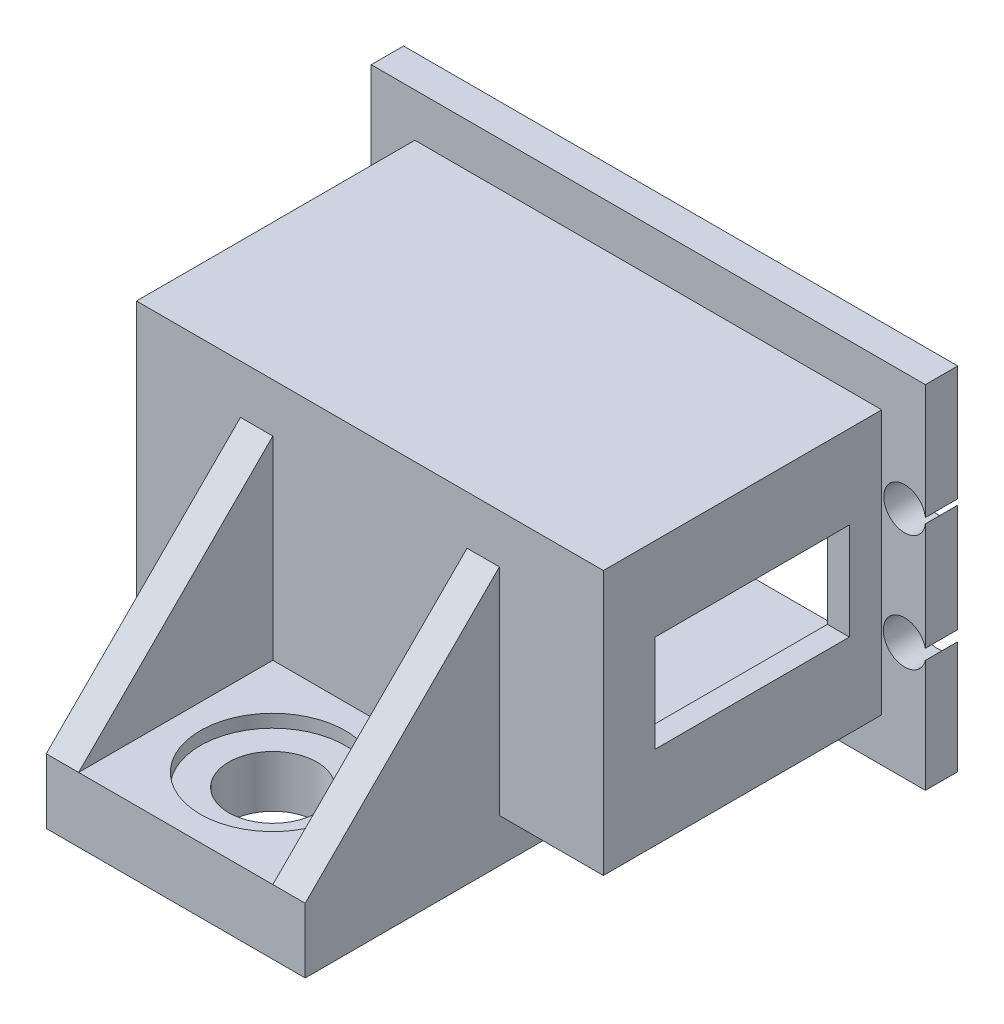
from build123d import *

# Parameters (mm, degrees)
SKETCH1_W           = 54.356
SKETCH1_H           = 34.4678
SKETCH1_W_2         = 40.2082
SKETCH1_H_2         = 20.32
BOSS_EXTRUDE1_DEPTH = 27.94
SKETCH2_W           = 54.356
SKETCH2_H           = 34.4678
SKETCH2_W_2         = 45.7962
SKETCH2_H_2         = 25.908
CUT_EXTRUDE1_DEPTH  = 24.765
SKETCH3_R           = 2.04968225
SKETCH3_R_2         = 2.0955
CUT_EXTRUDE2_DEPTH  = 43.618007851
SKETCH4_W           = 19.05
SKETCH4_H           = 9.525
CUT_EXTRUDE3_DEPTH  = 12.7
SKETCH5_W           = 45.7962
SKETCH5_H           = 25.908
BOSS_EXTRUDE2_DEPTH = 2.54
SKETCH6_W           = 25.4
SKETCH6_H           = 4.2799
BOSS_EXTRUDE3_DEPTH = 27.305
SKETCH7_W           = 25.4
SKETCH7_H           = 6.35
BOSS_EXTRUDE4_DEPTH = 19.05
SKETCH8_R           = 4.318
CUT_EXTRUDE4_DEPTH  = 19.05
SKETCH9_R           = 7.112
CUT_EXTRUDE5_DEPTH  = 1.27
SKETCH10_W          = 3.175
SKETCH10_H          = 19.05
BOSS_EXTRUDE5_DEPTH = 19.05
CHAMFER1_SIZE       = 19.05
SKETCH12_W          = 7.62
SKETCH12_H          = 31.75
BOSS_EXTRUDE6_DEPTH = 3.175
SKETCH13_W          = 41.4782
SKETCH13_H          = 21.59
CUT_EXTRUDE7_DEPTH  = 27.94


with BuildPart() as part:
    # Sketch1 → Boss-Extrude1 (new body)
    with BuildSketch(Plane.XY):
        Rectangle(SKETCH1_W, SKETCH1_H)
        Rectangle(SKETCH1_W_2, SKETCH1_H_2, mode=Mode.SUBTRACT)
    extrude(amount=-BOSS_EXTRUDE1_DEPTH)

    # Sketch2 → Cut-Extrude1 (cut)
    with BuildSketch(Plane.XY):
        Rectangle(SKETCH2_W, SKETCH2_H)
        Rectangle(SKETCH2_W_2, SKETCH2_H_2, mode=Mode.SUBTRACT)
    extrude(amount=-CUT_EXTRUDE1_DEPTH, mode=Mode.SUBTRACT)

    # Sketch3 → Cut-Extrude2 (cut, through all)
    with BuildSketch(Plane(origin=(0, 0, -27.94), x_dir=(-1, 0, 0), z_dir=(0, 0, -1))):
        with Locations((-25.146, 5.6769)):
            Circle(SKETCH3_R)
        with Locations((-25.146, -5.6769)):
            Circle(SKETCH3_R_2)
        with Locations((25.146, -5.6769)):
            Circle(SKETCH3_R_2)
        with Locations((25.146, 5.6769)):
            Circle(SKETCH3_R_2)
    extrude(amount=-CUT_EXTRUDE2_DEPTH, mode=Mode.SUBTRACT)

    # Sketch4 → Cut-Extrude3 (cut)
    with BuildSketch(Plane(origin=(22.8981, 0, 0), x_dir=(0, 0, -1), z_dir=(1, 0, 0))):
        with Locations((12.065, 0)):
            Rectangle(SKETCH4_W, SKETCH4_H)
    extrude(amount=-CUT_EXTRUDE3_DEPTH, mode=Mode.SUBTRACT)

    # Sketch5 → Boss-Extrude2 (add)
    with BuildSketch(Plane.XY):
        Rectangle(SKETCH5_W, SKETCH5_H)
    extrude(amount=BOSS_EXTRUDE2_DEPTH)

    # Sketch6 → Boss-Extrude3 (add)
    with BuildSketch(Plane.XY.offset(2.54)):
        with Locations((0, -15.09395)):
            Rectangle(SKETCH6_W, SKETCH6_H)
    extrude(amount=-BOSS_EXTRUDE3_DEPTH)

    # Sketch7 → Boss-Extrude4 (add)
    with BuildSketch(Plane.XY.offset(2.54)):
        with Locations((0, -14.0589)):
            Rectangle(SKETCH7_W, SKETCH7_H)
    extrude(amount=BOSS_EXTRUDE4_DEPTH)

    # Sketch8 → Cut-Extrude4 (cut)
    with BuildSketch(Plane(origin=(0, -10.8839, 0), x_dir=(1, 0, 0), z_dir=(0, 1, 0))):
        with Locations(Location((0, -12.065, 0), (0, 0, 270))):
            Circle(SKETCH8_R)
    extrude(amount=-CUT_EXTRUDE4_DEPTH, mode=Mode.SUBTRACT)

    # Sketch9 → Cut-Extrude5 (cut)
    with BuildSketch(Plane(origin=(0, -10.8839, 0), x_dir=(1, 0, 0), z_dir=(0, 1, 0))):
        with Locations(Location((0, -12.065, 0), (0, 0, 270))):
            Circle(SKETCH9_R)
    extrude(amount=-CUT_EXTRUDE5_DEPTH, mode=Mode.SUBTRACT)

    # Sketch10 → Boss-Extrude5 (add)
    with BuildSketch(Plane(origin=(0, -10.8839, 0), x_dir=(1, 0, 0), z_dir=(0, 1, 0))):
        with Locations((11.1125, -12.065)):
            Rectangle(SKETCH10_W, SKETCH10_H)
        with Locations((-11.1125, -12.065)):
            Rectangle(SKETCH10_W, SKETCH10_H)
    extrude(amount=BOSS_EXTRUDE5_DEPTH)

    # Chamfer1
    chamfer1_edges = [part.edges().sort_by_distance(p)[0] for p in [
        (-11.1125, 8.1661, 21.59),
        (11.1125, 8.1661, 21.59),
    ]]
    chamfer(chamfer1_edges, length=CHAMFER1_SIZE - 0.0001)  # a hair under: the kernel refuses the full size

    # Sketch12 → Boss-Extrude6 (add)
    with BuildSketch(Plane.XZ.offset(17.2339)):
        with Locations((0, -12.065)):
            Rectangle(SKETCH12_W, SKETCH12_H)
    extrude(amount=BOSS_EXTRUDE6_DEPTH)

    # Sketch13 → Cut-Extrude7 (cut)
    with BuildSketch(Plane(origin=(0, 0, -27.94), x_dir=(-1, 0, 0), z_dir=(0, 0, -1))):
        Rectangle(SKETCH13_W, SKETCH13_H)
    extrude(amount=-CUT_EXTRUDE7_DEPTH, mode=Mode.SUBTRACT)


solid = part.part
